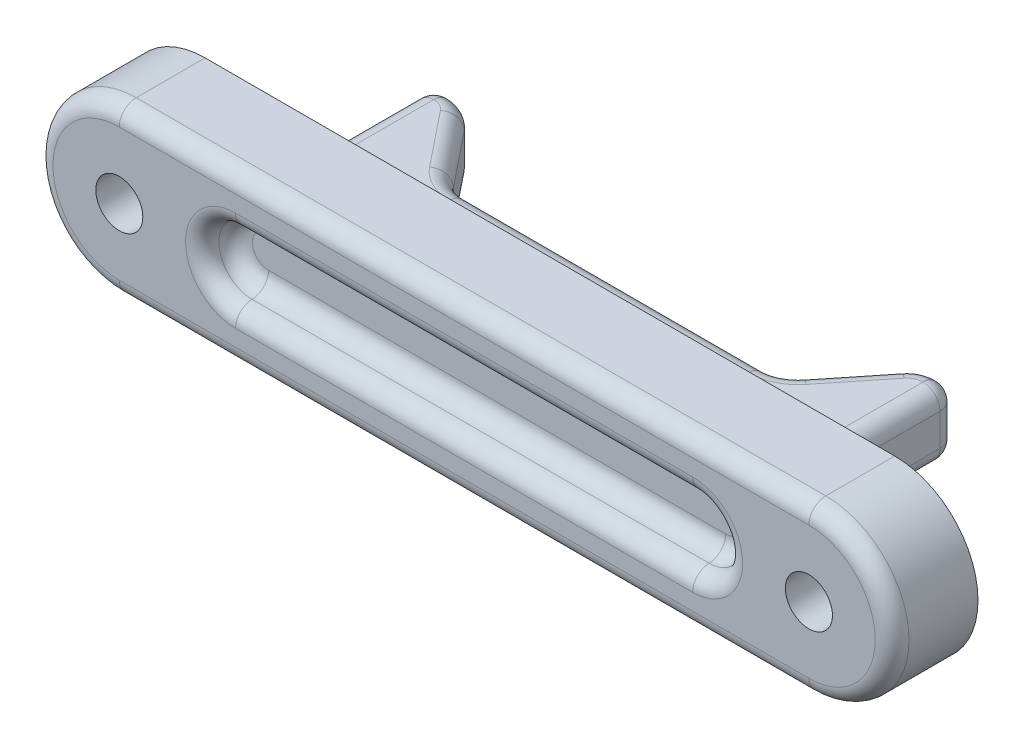
from build123d import *

# Parameters (mm, degrees)
BOSS_EXTRUDE1_DEPTH   = 4.1275
CUT_EXTRUDE1_DEPTH    = 1.5875
F_4_40_TAPPED_HOLE1_D = 2.2606
BOSS_EXTRUDE2_DEPTH   = 1.5875
FILLET1_R             = 1.5875
FILLET2_R             = 0.8128
FILLET3_R             = 0.8128
FILLET4_R             = 0.8128


with BuildPart() as part:
    # Sketch1 → Boss-Extrude1 (new body)
    with BuildSketch(Plane.XY):
        with BuildLine():
            Line((-16.5735, 4.0005), (16.5735, 4.0005))
            ThreePointArc((16.5735, 4.0005), (20.574, 0), (16.5735, -4.0005))
            Line((16.5735, -4.0005), (-16.5735, -4.0005))
            ThreePointArc((-16.5735, -4.0005), (-20.574, 0), (-16.5735, 4.0005))
        make_face()
    extrude(amount=BOSS_EXTRUDE1_DEPTH)

    # Sketch2 → Cut-Extrude1 (cut)
    with BuildSketch(Plane.XY.offset(4.1275)):
        with BuildLine():
            Line((-10.9855, 1.5875), (10.9855, 1.5875))
            ThreePointArc((10.9855, 1.5875), (12.573, 0), (10.9855, -1.5875))
            Line((10.9855, -1.5875), (-10.9855, -1.5875))
            ThreePointArc((-10.9855, -1.5875), (-12.573, 0), (-10.9855, 1.5875))
        make_face()
    extrude(amount=-CUT_EXTRUDE1_DEPTH, mode=Mode.SUBTRACT)

    # #4-40 Tapped Hole1 (through all)
    with Locations(Plane.XY.offset(4.1275)):
        with Locations((-16.5735, 0), (16.5735, 0)):
            Hole(F_4_40_TAPPED_HOLE1_D / 2)

    # Sketch5 → Boss-Extrude2 (add, symmetric)
    with BuildSketch(Plane(origin=(0, 0, 0), x_dir=(1, 0, 0), z_dir=(0, 1, 0))):
        Polygon((-12.573, 0), (-12.573, 6.985), (-10.9855, 6.985), (-7.9375, 3.175), (7.9375, 3.175), (10.9855, 6.985), (12.573, 6.985), (12.573, 0), align=None)
    extrude(amount=BOSS_EXTRUDE2_DEPTH, both=True)

    # Fillet1
    fillet1_edges = [part.edges().sort_by_distance(p)[0] for p in [
        (10.9855, 0, -6.985),
        (7.9375, 0, -3.175),
        (-7.9375, 0, -3.175),
        (-10.9855, 0, -6.985),
    ]]
    fillet(fillet1_edges, radius=FILLET1_R)

    # Fillet2
    fillet2_edges = [part.edges().sort_by_distance(p)[0] for p in [
        (12.573, -1.5875, -3.4925),
        (-12.573, -1.5875, -3.4925),
        (12.573, 1.5875, -3.4925),
        (-12.573, 1.5875, -3.4925),
    ]]
    fillet(fillet2_edges, radius=FILLET2_R)

    # Fillet3
    fillet3_edges = [part.edges().sort_by_distance(p)[0] for p in [
        (12.573, 0, 0),
        (11.754345973, -1.5875, -6.985),
        (11.754345973, 1.5875, -6.985),
        (12.334936392, 1.349436392, -6.985),
        (12.334936392, -1.349436392, -6.985),
        (0, -1.5875, 0),
        (0, 1.5875, 0),
        (-12.573, 0, 0),
        (-12.573, 0, -6.985),
        (-12.334936392, 1.349436392, -6.985),
        (-12.334936392, -1.349436392, -6.985),
        (12.334936392, -1.349436392, 0),
        (12.334936392, 1.349436392, 0),
        (-12.334936392, -1.349436392, 0),
        (-12.334936392, 1.349436392, 0),
        (-20.574, 0, 4.1275),
        (0, -4.0005, 4.1275),
        (12.573, 0, 4.1275),
        (0, 1.5875, 4.1275),
        (-12.573, 0, 4.1275),
        (0, -1.5875, 4.1275),
        (20.574, 0, 4.1275),
        (-11.754345973, -1.5875, -6.985),
        (-11.754345973, 1.5875, -6.985),
        (-9.4615, -1.5875, -5.08),
        (0, -1.5875, -3.175),
        (9.4615, -1.5875, -5.08),
        (11.060804836, -1.5875, -6.828318888),
        (-11.060804836, -1.5875, -6.828318888),
        (-9.4615, 1.5875, -5.08),
        (9.4615, 1.5875, -5.08),
        (0, 1.5875, -3.175),
        (11.060804836, 1.5875, -6.828318888),
        (-11.060804836, 1.5875, -6.828318888),
        (7.862195164, -1.5875, -3.331681112),
        (7.862195164, 1.5875, -3.331681112),
        (-7.862195164, -1.5875, -3.331681112),
        (-7.862195164, 1.5875, -3.331681112),
        (0, 4.0005, 4.1275),
        (12.573, 0, -6.985),
    ]]
    fillet(fillet3_edges, radius=FILLET3_R)

    # Fillet4
    # the kernel refuses this fillet: 0.8128 mm, written as the material it adds along each edge
    with BuildSketch(Plane(origin=(10.9855, -1.5875, 2.54), x_dir=(0, -0.00028128862329323027, 0.9999999604383545), z_dir=(-1, 0, 0)), Plane(origin=(-10.9855, 1.5875, 2.54), x_dir=(0, 0.00028128862329323027, 0.9999999604383545), z_dir=(1, 0, 0))) as fillet4_piece_1:
        with BuildLine():
            CenterArc((0.812571462, 0.812582054), FILLET4_R, 180.016116651, 88.657007194)
            Line((-0.000228506, 0.812353422), (-0.081508503, 0.812330559))
            Line((-0.081508503, 0.812330559), (-0.081279997, -2.2863e-05))
            Line((-0.081279997, -2.2863e-05), (2.2863e-05, -0.081279997))
            ThreePointArc((2.2863e-05, -0.081279997), (0.774722832, -0.081062082), (0.791867888, -0.081258205))
            Line((0.791867888, -0.081258205), (0.793750031, 0))
        make_face()
    extrude(amount=21.971)
    with BuildSketch(Plane(origin=(-10.9855, 0, 2.54), x_dir=(0, -1, 0), z_dir=(1, 0, 0))) as fillet4_piece_2:
        with BuildLine():
            CenterArc((0.775146546, -0.8128), FILLET4_R, 1.342992806, 88.657007194)
            Line((0.775146546, 0), (0.775146546, 0.08128))
            Line((0.775146546, 0.08128), (1.5875, 0.08128))
            Line((1.5875, 0.08128), (1.66878, 0))
            ThreePointArc((1.66878, 0), (1.66878, -0.7747), (1.668980946, -0.791845))
            Line((1.668980946, -0.791845), (1.587723273, -0.79375))
        make_face()
    revolve(axis=Axis((-10.9855, 0, 2.54), (0, 0, -1)), revolution_arc=180)
    with BuildSketch(Plane(origin=(10.9855, 0, 2.54), x_dir=(0, 1, 0), z_dir=(-1, 0, 0))) as fillet4_piece_3:
        with BuildLine():
            CenterArc((0.775146546, -0.8128), FILLET4_R, 1.342992806, 88.657007194)
            Line((0.775146546, 0), (0.775146546, 0.08128))
            Line((0.775146546, 0.08128), (1.5875, 0.08128))
            Line((1.5875, 0.08128), (1.66878, 0))
            ThreePointArc((1.66878, 0), (1.66878, -0.7747), (1.668980946, -0.791845))
            Line((1.668980946, -0.791845), (1.587723273, -0.79375))
        make_face()
    revolve(axis=Axis((10.9855, 0, 2.54), (0, 0, -1)), revolution_arc=180)


solid = part.part
